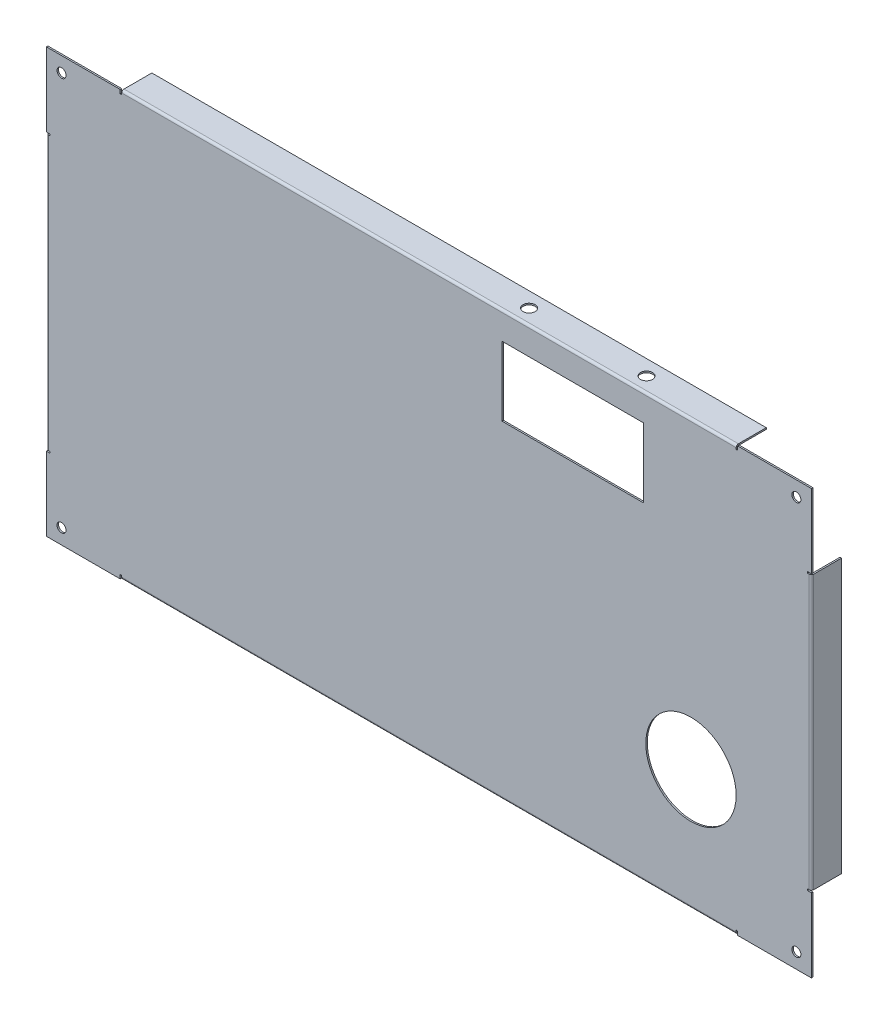
from build123d import *

# Parameters (mm, degrees)
SKETCH_1_W                        = 508
SKETCH_1_H                        = 281.5
SKETCH_1_R                        = 3
SKETCH_1_R_2                      = 30
SKETCH_1_W_2                      = 94
SKETCH_1_H_2                      = 46
SM_BASE_FLANGE_1_DEPTH            = 1
SM_EDGE_FLANGE_1_STRIP_W          = 5
SM_EDGE_FLANGE_1_STRIP_H          = 1
SM_EDGE_FLANGE_1_STRIP_CUT_DEPTH  = 408
SM_EDGE_FLANGE_1_RELIEF_W         = 6
SM_EDGE_FLANGE_1_RELIEF_H         = 1
SM_EDGE_FLANGE_1_RELIEF_CUT_DEPTH = 1
SM_EDGE_FLANGE_1_DEPTH            = 408
SM_EDGE_FLANGE_2_STRIP_W          = 5
SM_EDGE_FLANGE_2_STRIP_H          = 1
SM_EDGE_FLANGE_2_STRIP_CUT_DEPTH  = 181.5
SM_EDGE_FLANGE_2_RELIEF_W         = 6
SM_EDGE_FLANGE_2_RELIEF_H         = 1
SM_EDGE_FLANGE_2_RELIEF_CUT_DEPTH = 1
SM_EDGE_FLANGE_2_DEPTH            = 181.5
SM_EDGE_FLANGE_3_STRIP_W          = 5
SM_EDGE_FLANGE_3_STRIP_H          = 1
SM_EDGE_FLANGE_3_STRIP_CUT_DEPTH  = 408
SM_EDGE_FLANGE_3_RELIEF_W         = 6
SM_EDGE_FLANGE_3_RELIEF_H         = 1
SM_EDGE_FLANGE_3_RELIEF_CUT_DEPTH = 1
SM_EDGE_FLANGE_3_DEPTH            = 408
SM_EDGE_FLANGE_4_STRIP_W          = 5
SM_EDGE_FLANGE_4_STRIP_H          = 1
SM_EDGE_FLANGE_4_STRIP_CUT_DEPTH  = 181.5
SM_EDGE_FLANGE_4_RELIEF_W         = 6
SM_EDGE_FLANGE_4_RELIEF_H         = 1
SM_EDGE_FLANGE_4_RELIEF_CUT_DEPTH = 1
SM_EDGE_FLANGE_4_DEPTH            = 181.5
SKETCH_32_R                       = 4
CUT_EXTRUDE_1_DEPTH               = 379.940958462


# Sheet-metal steps are written as plain solids
with BuildPart() as part:
    # 基体-法兰1: sheet metal written as solids
    # Sketch 1 → 基体-法兰1 (new body)
    with BuildSketch(Plane.XY):
        Rectangle(SKETCH_1_W, SKETCH_1_H)
        with Locations((-244, 130.75)):
            Circle(SKETCH_1_R, mode=Mode.SUBTRACT)
        with Locations((-244, -130.75)):
            Circle(SKETCH_1_R, mode=Mode.SUBTRACT)
        with Locations((244, 130.75)):
            Circle(SKETCH_1_R, mode=Mode.SUBTRACT)
        with Locations((244, -130.75)):
            Circle(SKETCH_1_R, mode=Mode.SUBTRACT)
        with Locations((174, -60.75)):
            Circle(SKETCH_1_R_2, mode=Mode.SUBTRACT)
        with Locations((95.5, 99.75)):
            Rectangle(SKETCH_1_W_2, SKETCH_1_H_2, mode=Mode.SUBTRACT)
    extrude(amount=-SM_BASE_FLANGE_1_DEPTH)

    # 边线-法兰1: sheet metal written as solids
    # 边线-法兰1 strip (on a plane across the edge) → 边线-法兰1 strip cut (cut)
    with BuildSketch(Plane(origin=(-204, 140.75, -1), x_dir=(0, -1, 0), z_dir=(1, 0, 0))):
        with Locations((-1, -0.5)):
            Rectangle(SM_EDGE_FLANGE_1_STRIP_W, SM_EDGE_FLANGE_1_STRIP_H)
    extrude(amount=SM_EDGE_FLANGE_1_STRIP_CUT_DEPTH, mode=Mode.SUBTRACT)

    # 边线-法兰1 relief (on the sheet) → 边线-法兰1 relief cut (cut)
    with BuildSketch(Plane(origin=(-204, 139.25, -1), x_dir=(0, -1, 0), z_dir=(0, 0, -1))):
        with Locations((-2, 0.5)):
            Rectangle(SM_EDGE_FLANGE_1_RELIEF_W, SM_EDGE_FLANGE_1_RELIEF_H)
        with Locations((-2, -408.5)):
            Rectangle(SM_EDGE_FLANGE_1_RELIEF_W, SM_EDGE_FLANGE_1_RELIEF_H)
    extrude(amount=-SM_EDGE_FLANGE_1_RELIEF_CUT_DEPTH, mode=Mode.SUBTRACT)

    # 边线-法兰1 section (on a plane across the edge) → 边线-法兰1 (add)
    with BuildSketch(Plane(origin=(-204, 140.75, -1), x_dir=(0, -1, 0), z_dir=(1, 0, 0))):
        with BuildLine():
            Line((0, 0.5), (0, 19))
            Line((0, 19), (1, 19))
            Line((1, 19), (1, 0.5))
            ThreePointArc((1, 0.5), (1.146446609, 0.146446609), (1.5, 0))
            Line((1.5, 0), (1.5, -1))
            ThreePointArc((1.5, -1), (0.439339828, -0.560660172), (0, 0.5))
        make_face()
    extrude(amount=SM_EDGE_FLANGE_1_DEPTH)

    # 边线-法兰2: sheet metal written as solids
    # 边线-法兰2 strip (on a plane across the edge) → 边线-法兰2 strip cut (cut)
    with BuildSketch(Plane(origin=(-254, -90.75, -1), x_dir=(1, 0, 0), z_dir=(0, 1, 0))):
        with Locations((-1, -0.5)):
            Rectangle(SM_EDGE_FLANGE_2_STRIP_W, SM_EDGE_FLANGE_2_STRIP_H)
    extrude(amount=SM_EDGE_FLANGE_2_STRIP_CUT_DEPTH, mode=Mode.SUBTRACT)

    # 边线-法兰2 relief (on the sheet) → 边线-法兰2 relief cut (cut)
    with BuildSketch(Plane(origin=(-252.5, -90.75, -1), x_dir=(1, 0, 0), z_dir=(0, 0, -1))):
        with Locations((-2, 0.5)):
            Rectangle(SM_EDGE_FLANGE_2_RELIEF_W, SM_EDGE_FLANGE_2_RELIEF_H)
        with Locations((-2, -182)):
            Rectangle(SM_EDGE_FLANGE_2_RELIEF_W, SM_EDGE_FLANGE_2_RELIEF_H)
    extrude(amount=-SM_EDGE_FLANGE_2_RELIEF_CUT_DEPTH, mode=Mode.SUBTRACT)

    # 边线-法兰2 section (on a plane across the edge) → 边线-法兰2 (add)
    with BuildSketch(Plane(origin=(-254, -90.75, -1), x_dir=(1, 0, 0), z_dir=(0, 1, 0))):
        with BuildLine():
            Line((0, 0.5), (0, 19))
            Line((0, 19), (1, 19))
            Line((1, 19), (1, 0.5))
            ThreePointArc((1, 0.5), (1.146446609, 0.146446609), (1.5, 0))
            Line((1.5, 0), (1.5, -1))
            ThreePointArc((1.5, -1), (0.439339828, -0.560660172), (0, 0.5))
        make_face()
    extrude(amount=SM_EDGE_FLANGE_2_DEPTH)

    # 边线-法兰3: sheet metal written as solids
    # 边线-法兰3 strip (on a plane across the edge) → 边线-法兰3 strip cut (cut)
    with BuildSketch(Plane(origin=(204, -140.75, -1), x_dir=(0, 1, 0), z_dir=(-1, 0, 0))):
        with Locations((-1, -0.5)):
            Rectangle(SM_EDGE_FLANGE_3_STRIP_W, SM_EDGE_FLANGE_3_STRIP_H)
    extrude(amount=SM_EDGE_FLANGE_3_STRIP_CUT_DEPTH, mode=Mode.SUBTRACT)

    # 边线-法兰3 relief (on the sheet) → 边线-法兰3 relief cut (cut)
    with BuildSketch(Plane(origin=(204, -139.25, -1), x_dir=(0, 1, 0), z_dir=(0, 0, -1))):
        with Locations((-2, 0.5)):
            Rectangle(SM_EDGE_FLANGE_3_RELIEF_W, SM_EDGE_FLANGE_3_RELIEF_H)
        with Locations((-2, -408.5)):
            Rectangle(SM_EDGE_FLANGE_3_RELIEF_W, SM_EDGE_FLANGE_3_RELIEF_H)
    extrude(amount=-SM_EDGE_FLANGE_3_RELIEF_CUT_DEPTH, mode=Mode.SUBTRACT)

    # 边线-法兰3 section (on a plane across the edge) → 边线-法兰3 (add)
    with BuildSketch(Plane(origin=(204, -140.75, -1), x_dir=(0, 1, 0), z_dir=(-1, 0, 0))):
        with BuildLine():
            Line((0, 0.5), (0, 19))
            Line((0, 19), (1, 19))
            Line((1, 19), (1, 0.5))
            ThreePointArc((1, 0.5), (1.146446609, 0.146446609), (1.5, 0))
            Line((1.5, 0), (1.5, -1))
            ThreePointArc((1.5, -1), (0.439339828, -0.560660172), (0, 0.5))
        make_face()
    extrude(amount=SM_EDGE_FLANGE_3_DEPTH)

    # 边线-法兰4: sheet metal written as solids
    # 边线-法兰4 strip (on a plane across the edge) → 边线-法兰4 strip cut (cut)
    with BuildSketch(Plane(origin=(254, 90.75, -1), x_dir=(-1, 0, 0), z_dir=(0, -1, 0))):
        with Locations((-1, -0.5)):
            Rectangle(SM_EDGE_FLANGE_4_STRIP_W, SM_EDGE_FLANGE_4_STRIP_H)
    extrude(amount=SM_EDGE_FLANGE_4_STRIP_CUT_DEPTH, mode=Mode.SUBTRACT)

    # 边线-法兰4 relief (on the sheet) → 边线-法兰4 relief cut (cut)
    with BuildSketch(Plane(origin=(252.5, 90.75, -1), x_dir=(-1, 0, 0), z_dir=(0, 0, -1))):
        with Locations((-2, 0.5)):
            Rectangle(SM_EDGE_FLANGE_4_RELIEF_W, SM_EDGE_FLANGE_4_RELIEF_H)
        with Locations((-2, -182)):
            Rectangle(SM_EDGE_FLANGE_4_RELIEF_W, SM_EDGE_FLANGE_4_RELIEF_H)
    extrude(amount=-SM_EDGE_FLANGE_4_RELIEF_CUT_DEPTH, mode=Mode.SUBTRACT)

    # 边线-法兰4 section (on a plane across the edge) → 边线-法兰4 (add)
    with BuildSketch(Plane(origin=(254, 90.75, -1), x_dir=(-1, 0, 0), z_dir=(0, -1, 0))):
        with BuildLine():
            Line((0, 0.5), (0, 19))
            Line((0, 19), (1, 19))
            Line((1, 19), (1, 0.5))
            ThreePointArc((1, 0.5), (1.146446609, 0.146446609), (1.5, 0))
            Line((1.5, 0), (1.5, -1))
            ThreePointArc((1.5, -1), (0.439339828, -0.560660172), (0, 0.5))
        make_face()
    extrude(amount=SM_EDGE_FLANGE_4_DEPTH)

    # 草图32 → 切除-拉伸1 (cut, through all)
    with BuildSketch(Plane(origin=(0, 139.75, 0), x_dir=(-1, 0, 0), z_dir=(0, -1, 0))):
        with Locations(Location((-134.5, 10, 0), (0, 0, 90))):
            Circle(SKETCH_32_R)
        with Locations(Location((-56.5, 10, 0), (0, 0, 90))):
            Circle(SKETCH_32_R)
    extrude(amount=-CUT_EXTRUDE_1_DEPTH, mode=Mode.SUBTRACT)


solid = part.part
